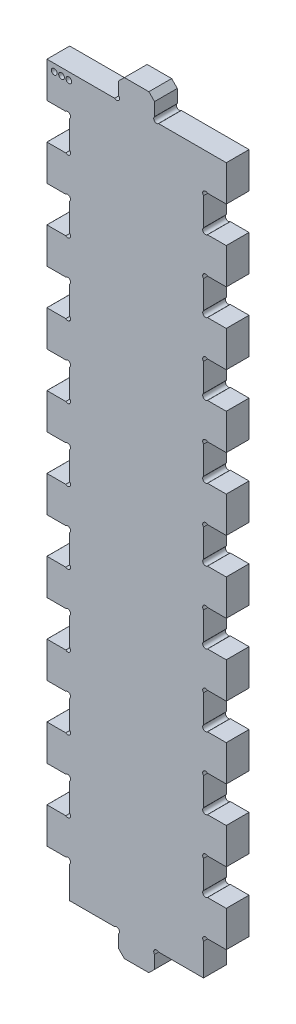
from build123d import *

# Parameters (mm, degrees)
SKETCH1_W           = 50.000000076
SKETCH1_H           = 200.000108
BOSS_EXTRUDE1_DEPTH = 6.35
SKETCH2_W           = 10.0000054
SKETCH2_H           = 6.35
BOSS_EXTRUDE2_DEPTH = 6.35
SKETCH3_W           = 6.35
SKETCH3_H           = 10.0000054
CUT_EXTRUDE1_DEPTH  = 6.35
LPATTERN2_COUNT     = 10
LPATTERN2_PITCH     = 20.0000108
SKETCH4_R           = 0.79375
CUT_EXTRUDE3_DEPTH  = 6.35
LPATTERN3_COUNT     = 9
LPATTERN3_PITCH     = 20.0000108
CHAMFER1_SIZE       = 1.5875
SKETCH5_R           = 0.79375
CUT_EXTRUDE4_DEPTH  = 6.35
SKETCH11_R          = 0.79375
CUT_EXTRUDE10_DEPTH = 213.416311942
SKETCH13_W          = 6.3240118
SKETCH13_H          = 10.0254054
CUT_EXTRUDE12_DEPTH = 213.416311942
LPATTERN6_COUNT     = 10
LPATTERN6_PITCH     = 20.0000108
SKETCH15_R          = 0.79375
CUT_EXTRUDE14_DEPTH = 3.175
LPATTERN8_COUNT     = 3
LPATTERN8_PITCH     = 2.032


with BuildPart() as part:
    # Sketch1 → Boss-Extrude1 (new body)
    with BuildSketch(Plane.XY):
        with Locations((25.000000038, 100.000054)):
            Rectangle(SKETCH1_W, SKETCH1_H)
    extrude(amount=BOSS_EXTRUDE1_DEPTH)

    # Sketch2 → Boss-Extrude2 (add)
    with BuildSketch(Plane.XY):
        with Locations((25.000000038, 203.175108)):
            Rectangle(SKETCH2_W, SKETCH2_H)
        with Locations((25.000000038, -3.175)):
            Rectangle(SKETCH2_W, SKETCH2_H)
    extrude(amount=BOSS_EXTRUDE2_DEPTH)

    # Sketch3 → Cut-Extrude1 (cut)
    with BuildSketch(Plane.XY.offset(6.35)):
        with Locations((3.175, 5.0000027)):
            Rectangle(SKETCH3_W, SKETCH3_H)
        with Locations((46.825000076, 5.0000027)):
            Rectangle(SKETCH3_W, SKETCH3_H)
    cut_extrude1 = extrude(amount=-CUT_EXTRUDE1_DEPTH, mode=Mode.SUBTRACT)

    # LPattern2: Cut-Extrude1 ×10
    with Locations(*[(0, i * LPATTERN2_PITCH, 0) for i in range(1, LPATTERN2_COUNT)]):
        add(cut_extrude1, mode=Mode.SUBTRACT)

    # Sketch4 → Cut-Extrude3 (cut)
    with BuildSketch(Plane.XY.offset(6.35)):
        with Locations((5.788733992, 9.438739392)):
            Circle(SKETCH4_R)
        with Locations((5.788733992, 20.561276808)):
            Circle(SKETCH4_R)
        with Locations((44.211266084, 20.561276808)):
            Circle(SKETCH4_R)
        with Locations((44.211266084, 9.438739392)):
            Circle(SKETCH4_R)
    cut_extrude3 = extrude(amount=-CUT_EXTRUDE3_DEPTH, mode=Mode.SUBTRACT)

    # LPattern3: Cut-Extrude3 ×9
    with Locations(*[(0, i * LPATTERN3_PITCH, 0) for i in range(1, LPATTERN3_COUNT)]):
        add(cut_extrude3, mode=Mode.SUBTRACT)

    # Chamfer1
    chamfer1_edges = [part.edges().sort_by_distance(p)[0] for p in [
        (30.000002738, -6.35, 3.175),
        (19.999997338, -6.35, 3.175),
        (19.999997338, 206.350108, 3.175),
        (30.000002738, 206.350108, 3.175),
    ]]
    chamfer(chamfer1_edges, length=CHAMFER1_SIZE)

    # Sketch5 → Cut-Extrude4 (cut)
    with BuildSketch(Plane.XY.offset(6.35)):
        with Locations((5.788733992, 189.438836592)):
            Circle(SKETCH5_R)
        with Locations((44.211266084, 189.438836592)):
            Circle(SKETCH5_R)
    extrude(amount=-CUT_EXTRUDE4_DEPTH, mode=Mode.SUBTRACT)

    # Sketch11 → Cut-Extrude10 (cut, through all)
    with BuildSketch(Plane.XY):
        with Locations((19.43873133, 200.561374008)):
            Circle(SKETCH11_R)
        with Locations((30.561268746, 200.561374008)):
            Circle(SKETCH11_R)
        with Locations((19.43873133, -0.561266008)):
            Circle(SKETCH11_R)
        with Locations((30.561268746, -0.561266008)):
            Circle(SKETCH11_R)
    extrude(amount=CUT_EXTRUDE10_DEPTH, mode=Mode.SUBTRACT)

    # Sketch13 → Cut-Extrude12 (cut, through all)
    with BuildSketch(Plane.XY.offset(6.35)):
        with Locations((3.175, 5.0000027)):
            Rectangle(SKETCH13_W, SKETCH13_H)
        with Locations((46.825000076, 5.0000027)):
            Rectangle(SKETCH13_W, SKETCH13_H)
    cut_extrude12 = extrude(amount=-CUT_EXTRUDE12_DEPTH, mode=Mode.SUBTRACT)

    # LPattern6: Cut-Extrude12 ×10
    with Locations(*[(0, i * LPATTERN6_PITCH, 0) for i in range(1, LPATTERN6_COUNT)]):
        add(cut_extrude12, mode=Mode.SUBTRACT)

    # Sketch15 → Cut-Extrude14 (cut)
    with BuildSketch(Plane.XY.offset(6.35)):
        with Locations((2.032, 197.968108)):
            Circle(SKETCH15_R)
    cut_extrude14 = extrude(amount=-CUT_EXTRUDE14_DEPTH, mode=Mode.SUBTRACT)

    # LPattern8: Cut-Extrude14 ×3
    with Locations(*[(i * LPATTERN8_PITCH, 0, 0) for i in range(1, LPATTERN8_COUNT)]):
        add(cut_extrude14, mode=Mode.SUBTRACT)


solid = part.part
